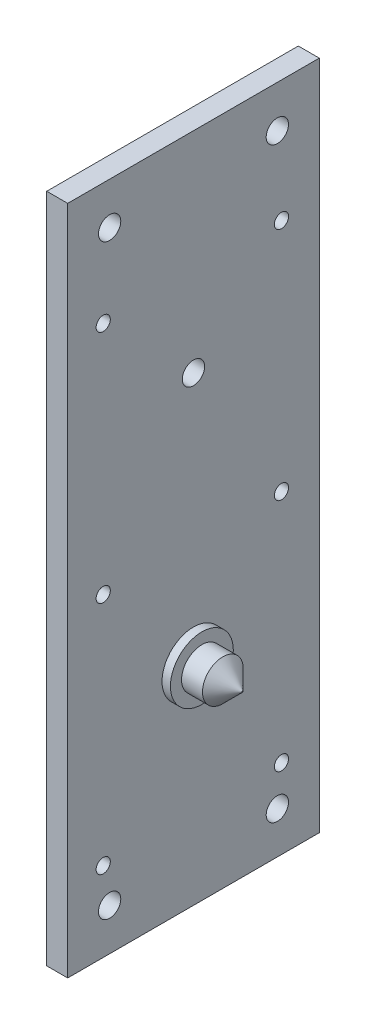
from build123d import *

# Parameters (mm, degrees)
SKETCH1_W               = 76.2
SKETCH1_H               = 203.2
BOSS_EXTRUDE1_DEPTH     = 6.35
SKETCH6_R               = 9.525
BOSS_EXTRUDE4_DEPTH     = 2.54
SKETCH5_R               = 6.1595
BOSS_EXTRUDE3_DEPTH     = 12.319
CHAMFER1_SIZE           = 5.969
F_1_4_CLEARANCE_HOLE1_D = 6.7564
SKETCH12_R              = 2.15
CUT_EXTRUDE3_DEPTH      = 6.35


with BuildPart() as part:
    # Sketch1 → Boss-Extrude1 (new body)
    with BuildSketch(Plane(origin=(0, 0, 0), x_dir=(0, 0, -1), z_dir=(1, 0, 0))):
        with Locations((0, 38.1)):
            Rectangle(SKETCH1_W, SKETCH1_H)
    extrude(amount=BOSS_EXTRUDE1_DEPTH)

    # Sketch6 → Boss-Extrude4 (add)
    with BuildSketch(Plane(origin=(6.35, 0, 0), x_dir=(0, 0, -1), z_dir=(1, 0, 0))):
        Circle(SKETCH6_R)
    extrude(amount=BOSS_EXTRUDE4_DEPTH)

    # Sketch5 → Boss-Extrude3 (add)
    with BuildSketch(Plane(origin=(8.89, 0, 0), x_dir=(0, 0, -1), z_dir=(1, 0, 0))):
        Circle(SKETCH5_R)
    extrude(amount=BOSS_EXTRUDE3_DEPTH)

    # Chamfer1
    chamfer1_edges = [part.edges().sort_by_distance(p)[0] for p in [
        (21.209, 0, 6.1595),
    ]]
    chamfer(chamfer1_edges, length=CHAMFER1_SIZE)

    # 1/4 Clearance Hole1 (through all)
    with Locations(Plane(origin=(6.35, 0, 0), x_dir=(0, 0, -1), z_dir=(1, 0, 0))):
        with Locations((0, 76.2), (25.4, -50.8), (-25.4, -50.8), (-25.4, 127), (25.4, 127)):
            Hole(F_1_4_CLEARANCE_HOLE1_D / 2)

    # Sketch12 → Cut-Extrude3 (cut)
    with BuildSketch(Plane.ZY):
        with Locations((-26.646533, -39.402759)):
            Circle(SKETCH12_R)
        with Locations((-26.646533, 31.717241)):
            Circle(SKETCH12_R)
        with Locations((-26.646533, 102.837241)):
            Circle(SKETCH12_R)
        with Locations((27.342012, 102.837241)):
            Circle(SKETCH12_R)
        with Locations((27.342012, 31.717241)):
            Circle(SKETCH12_R)
        with Locations((27.342012, -39.402759)):
            Circle(SKETCH12_R)
    extrude(amount=-CUT_EXTRUDE3_DEPTH, mode=Mode.SUBTRACT)


solid = part.part
